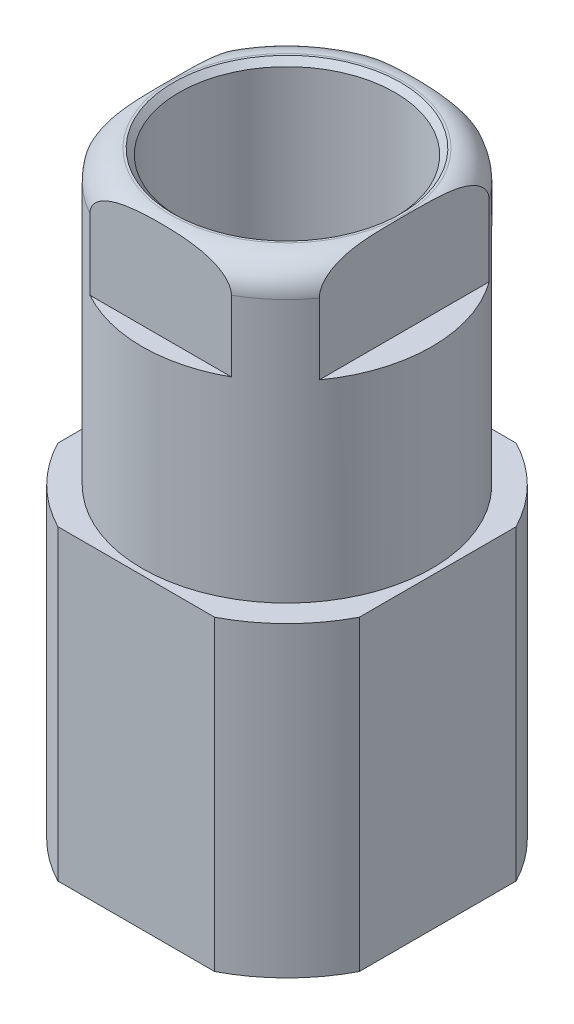
from build123d import *

# Parameters (mm, degrees)
SKETCH1_W                 = 16.75
SKETCH1_H                 = 16.75
BOSS_EXTRUDE2_DEPTH       = 17.05
SKETCH3_OUTSIDE_W         = 24.588
SKETCH3_OUTSIDE_H         = 24.588
SKETCH3_OUTSIDE_R         = 9.44
CUT_EXTRUDE1_DEPTH        = 17.05
SKETCH4_R                 = 8.045
BOSS_EXTRUDE3_DEPTH       = 16.2
FILLET1_R                 = 1.6
SKETCH6_OUTSIDE_W         = 26.916
SKETCH6_OUTSIDE_H         = 26.916
SKETCH6_OUTSIDE_W_2       = 13.03
SKETCH6_OUTSIDE_H_2       = 14.04
CUT_EXTRUDE2_DEPTH        = 5.53
SKETCH8_R                 = 6
CUT_EXTRUDE3_DEPTH        = 12.7
CHAMFER5_SIZE             = 0.32
M10_CLEARANCE_HOLE2_D     = 11
M10_CLEARANCE_HOLE2_DEPTH = 8.775266595
M10_CLEARANCE_HOLE2_TIP   = 3.304733405
CHAMFER7_SIZE             = 1
THREAD2_PITCH             = 1


with BuildPart() as part:
    # Sketch1 → Boss-Extrude2 (new body)
    with BuildSketch(Plane(origin=(0, 0, 0), x_dir=(1, 0, 0), z_dir=(0, 1, 0))):
        Rectangle(SKETCH1_W, SKETCH1_H)
    extrude(amount=BOSS_EXTRUDE2_DEPTH)

    # Sketch3 outside → Cut-Extrude1 (cut)
    with BuildSketch(Plane.XZ):
        Rectangle(SKETCH3_OUTSIDE_W, SKETCH3_OUTSIDE_H)
        Circle(SKETCH3_OUTSIDE_R, mode=Mode.SUBTRACT)
    extrude(amount=-CUT_EXTRUDE1_DEPTH, mode=Mode.SUBTRACT)

    # Sketch4 → Boss-Extrude3 (add)
    with BuildSketch(Plane(origin=(0, 17.05, 0), x_dir=(1, 0, 0), z_dir=(0, 1, 0))):
        with Locations(Location((0, 0, 0), (0, 0, 270))):
            Circle(SKETCH4_R)
    extrude(amount=BOSS_EXTRUDE3_DEPTH)

    # Fillet1
    fillet1_edges = [part.edges().sort_by_distance(p)[0] for p in [
        (0, 33.25, -8.045),
    ]]
    fillet(fillet1_edges, radius=FILLET1_R)

    # Sketch6 outside → Cut-Extrude2 (cut)
    with BuildSketch(Plane(origin=(0, 33.25, 0), x_dir=(1, 0, 0), z_dir=(0, 1, 0))):
        Rectangle(SKETCH6_OUTSIDE_W, SKETCH6_OUTSIDE_H)
        Rectangle(SKETCH6_OUTSIDE_W_2, SKETCH6_OUTSIDE_H_2, mode=Mode.SUBTRACT)
    extrude(amount=-CUT_EXTRUDE2_DEPTH, mode=Mode.SUBTRACT)

    # Sketch8 → Cut-Extrude3 (cut)
    with BuildSketch(Plane(origin=(0, 33.25, 0), x_dir=(1, 0, 0), z_dir=(0, 1, 0))):
        with Locations(Location((0, 0, 0), (0, 0, 270))):
            Circle(SKETCH8_R)
    extrude(amount=-CUT_EXTRUDE3_DEPTH, mode=Mode.SUBTRACT)

    # Chamfer5
    chamfer5_edges = [part.edges().sort_by_distance(p)[0] for p in [
        (0, 33.25, -6),
    ]]
    chamfer(chamfer5_edges, length=CHAMFER5_SIZE)

    # M10 Clearance Hole2
    with Locations(Plane(origin=(0, 20.55, 0), x_dir=(1, 0, 0), z_dir=(0, 1, 0))):
        with Locations((0, 0)):
            Hole(M10_CLEARANCE_HOLE2_D / 2, depth=M10_CLEARANCE_HOLE2_DEPTH)
            with Locations((0, 0, -(M10_CLEARANCE_HOLE2_DEPTH + M10_CLEARANCE_HOLE2_TIP / 2))):  # 118° drill point
                Cone(0, M10_CLEARANCE_HOLE2_D / 2, M10_CLEARANCE_HOLE2_TIP, mode=Mode.SUBTRACT)

    # Chamfer7
    # the kernel refuses this chamfer: 1 mm, written as the material it takes off along each edge
    with BuildSketch(Plane(origin=(0, 20.55, 0), x_dir=(-1, 0, 0), z_dir=(0, 0, 1))) as chamfer7_piece_1_section:
        Polygon((5.5 + CHAMFER7_SIZE, 0), (5.5, CHAMFER7_SIZE), (5.5, 0), align=None)
    chamfer7_piece_1 = revolve(axis=Axis((0, 20.55, 0), (0, -1, 0)), mode=Mode.PRIVATE)
    chamfer7_piece_1 = chamfer7_piece_1 & Plane(origin=(0, 19.803167512, 0), x_dir=(0, 0, 1), z_dir=(0, 1, 0)) * Cylinder(6, 26, mode=Mode.PRIVATE)
    add(chamfer7_piece_1, mode=Mode.SUBTRACT)

    # Thread2: the profile of Thread Profile2 profile screwed along a right-hand helix of 7.775267 turns, 8 arcs to a turn; built about Z, then put on its axis
    thread2_z = Axis((0, 0, 0), (0, 0, 1))
    thread2_corners = [(5.4997, 0, -0.000173205), (6.041265875, 0, 0.312499999), (6.041265875, 0, 0.437499999), (5.4997, 0, 0.750173202)]
    with BuildLine(mode=Mode.PRIVATE) as thread2_profile:
        Line(thread2_corners[0], thread2_corners[1])
        Line(thread2_corners[1], thread2_corners[2])
        Line(thread2_corners[2], thread2_corners[3])
        Line(thread2_corners[3], thread2_corners[0])
    thread2_cap = Face(thread2_profile.wire())
    thread2_turn_angles = [0, 22.5, 45, 67.5, 90, 112.5, 135, 157.5, 180, 202.5, 225, 247.5, 270, 292.5, 315, 337.5, 360]
    thread2_turn_weights = [1, 0.9238795325112867, 1, 0.9238795325112867, 1, 0.9238795325112867, 1, 0.9238795325112867, 1, 0.9238795325112867, 1, 0.9238795325112867, 1, 0.9238795325112867, 1, 0.9238795325112867, 1]
    thread2_turn_rails = [Edge.make_bspline([Vector(p[0], p[1], 0).rotate(thread2_z, thread2_turn_angles[k]) / thread2_turn_weights[k] + Vector(0, 0, p[2] + THREAD2_PITCH * thread2_turn_angles[k] / 360) for k in range(17)], [0, 0, 0, 1, 1, 2, 2, 3, 3, 4, 4, 5, 5, 6, 6, 7, 7, 8, 8, 8], 2, thread2_turn_weights) for p in thread2_corners]
    thread2_turn_sides = [Face.make_surface_from_curves(thread2_turn_rails[p[0]], thread2_turn_rails[p[1]]) for p in [(0, 1), (1, 2), (2, 3), (3, 0)]]
    thread2_last_angles = [2520, 2542.5, 2565, 2587.5, 2610, 2632.5, 2655, 2677.5, 2700, 2722.5, 2745, 2767.5, 2790, 2794.547987163, 2799.095974325]
    thread2_last_weights = [1, 0.9238795325112867, 1, 0.9238795325112867, 1, 0.9238795325112867, 1, 0.9238795325112867, 1, 0.9238795325112867, 1, 0.9238795325112867, 1, 0.9968512719310885, 1]
    thread2_last_rails = [Edge.make_bspline([Vector(p[0], p[1], 0).rotate(thread2_z, thread2_last_angles[k]) / thread2_last_weights[k] + Vector(0, 0, p[2] + THREAD2_PITCH * thread2_last_angles[k] / 360) for k in range(15)], [0, 0, 0, 1, 1, 2, 2, 3, 3, 4, 4, 5, 5, 6, 6, 7, 7, 7], 2, thread2_last_weights) for p in thread2_corners]
    thread2_last_sides = [Face.make_surface_from_curves(thread2_last_rails[p[0]], thread2_last_rails[p[1]]) for p in [(0, 1), (1, 2), (2, 3), (3, 0)]]
    thread2 = Plane(origin=(0, 19.55, 0), x_dir=(-1, 0, 0), z_dir=(0, -1, 0)) * Solid(Shell([*[p.moved(Location((0, 0, THREAD2_PITCH * i))) for i in range(7) for p in thread2_turn_sides], *thread2_last_sides, thread2_cap, thread2_cap.rotate(thread2_z, 2799.095974325).moved(Location((0, 0, THREAD2_PITCH * 2799.095974325 / 360)))]))
    add(thread2, mode=Mode.SUBTRACT)


solid = part.part
